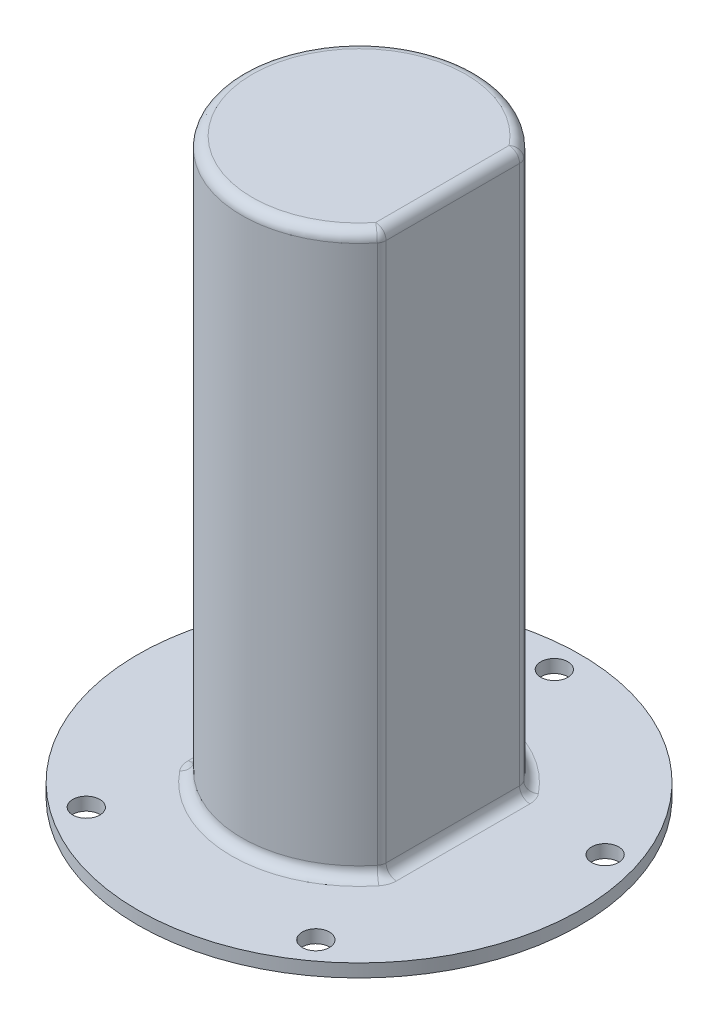
from build123d import *

# Parameters (mm, degrees)
SKETCH1_R           = 53.975
SKETCH1_R_2         = 3.302
BOSS_EXTRUDE1_DEPTH = 3.175
SKETCH2_R           = 28.575
BOSS_EXTRUDE2_DEPTH = 136.525
SKETCH3_W           = 40.450959828
SKETCH3_H           = 34.29
CUT_EXTRUDE1_DEPTH  = 136.525
SKETCH4_W           = 24.671855952
SKETCH4_H           = 34.29
CUT_EXTRUDE2_DEPTH  = 49.53
FILLET1_R           = 2.54


with BuildPart() as part:
    # Sketch1 → Boss-Extrude1 (new body)
    with BuildSketch(Plane(origin=(0, 0, 0), x_dir=(1, 0, 0), z_dir=(0, 1, 0))):
        with Locations(Location((0, 0, 0), (0, 0, 270))):
            Circle(SKETCH1_R)
        with Locations(Location((0, 47.625, 0), (0, 0, 270))):
            Circle(SKETCH1_R_2, mode=Mode.SUBTRACT)
        with Locations(Location((45.294066589, 14.716934357, 0), (0, 0, 270))):
            Circle(SKETCH1_R_2, mode=Mode.SUBTRACT)
        with Locations(Location((27.99327264, -38.529434357, 0), (0, 0, 270))):
            Circle(SKETCH1_R_2, mode=Mode.SUBTRACT)
        with Locations(Location((-27.99327264, -38.529434357, 0), (0, 0, 270))):
            Circle(SKETCH1_R_2, mode=Mode.SUBTRACT)
        with Locations(Location((-45.294066589, 14.716934357, 0), (0, 0, 270))):
            Circle(SKETCH1_R_2, mode=Mode.SUBTRACT)
    extrude(amount=BOSS_EXTRUDE1_DEPTH)

    # Sketch2 → Boss-Extrude2 (add)
    with BuildSketch(Plane(origin=(0, 3.175, 0), x_dir=(1, 0, 0), z_dir=(0, 1, 0))):
        with Locations(Location((0, 0, 0), (0, 0, 270))):
            Circle(SKETCH2_R)
    extrude(amount=BOSS_EXTRUDE2_DEPTH)

    # Sketch3 → Cut-Extrude1 (cut)
    with BuildSketch(Plane(origin=(0, 139.7, 0), x_dir=(1, 0, 0), z_dir=(0, 1, 0))):
        with Locations((43.085479914, 0)):
            Rectangle(SKETCH3_W, SKETCH3_H)
    extrude(amount=-CUT_EXTRUDE1_DEPTH, mode=Mode.SUBTRACT)

    # Sketch4 → Cut-Extrude2 (cut)
    with BuildSketch(Plane(origin=(0, 3.175, 0), x_dir=(1, 0, 0), z_dir=(0, 1, 0))):
        with Locations((-35.195927976, 0)):
            Rectangle(SKETCH4_W, SKETCH4_H)
    extrude(amount=CUT_EXTRUDE2_DEPTH, mode=Mode.SUBTRACT)

    # Fillet1
    fillet1_edges = [part.edges().sort_by_distance(p)[0] for p in [
        (-28.575, 139.7, 0),
        (22.86, 139.7, 0),
        (22.86, 71.4375, 17.145),
        (22.86, 71.4375, -17.145),
        (-28.575, 52.705, 0),
        (-22.86, 27.94, 17.145),
        (-22.86, 27.94, -17.145),
    ]]
    fillet(fillet1_edges, radius=FILLET1_R)
    fillet1_2_edges = [part.edges().sort_by_distance(p)[0] for p in [
        (0, 3.175, -28.575),
        (22.86, 3.175, 0),
        (0, 3.175, 28.575),
        (-22.86, 3.175, 0),
        (-22.716559526, 3.175, -17.117815364),
        (-22.716559526, 3.175, 17.117815364),
        (22.716559526, 3.175, 17.117815364),
        (22.716559526, 3.175, -17.117815364),
    ]]
    fillet(fillet1_2_edges, radius=FILLET1_R)


solid = part.part
